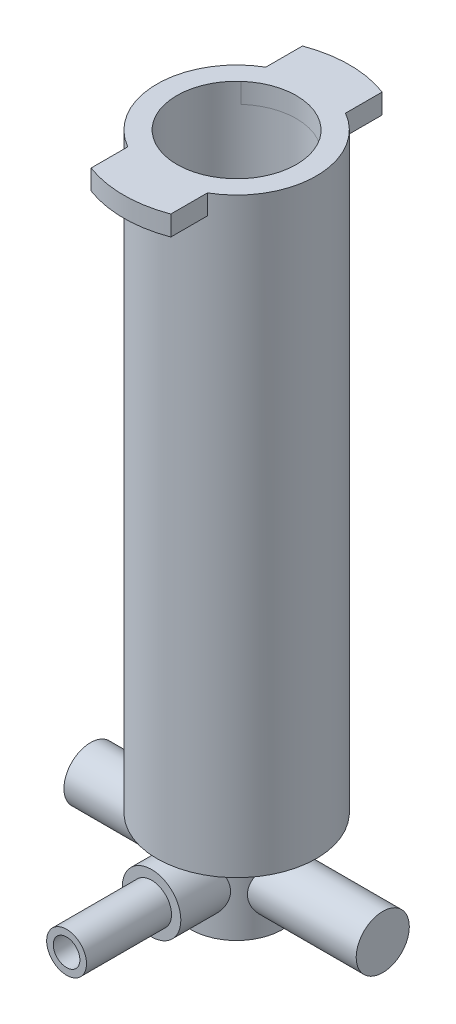
from build123d import *

# Parameters (mm, degrees)
SKETCH1_R           = 6
BOSS_EXTRUDE1_DEPTH = 44.5
SHELL1_T            = -1.5
SKETCH3_R           = 3.45
BOSS_EXTRUDE3_DEPTH = 5.9
SHELL2_START        = -4.4
SHELL2_OUTLINE_R    = 1.95
SHELL2_DEPTH        = 5.9
SKETCH5_R           = 2.2
BOSS_EXTRUDE4_DEPTH = 6.4
SKETCH6_R           = 1.5
BOSS_EXTRUDE5_DEPTH = 6.4
SKETCH7_R           = 1
CUT_EXTRUDE1_DEPTH  = 12.4
SKETCH8_R           = 1.95
CUT_EXTRUDE2_DEPTH  = 51.902357509
SKETCH9_R           = 2
BOSS_EXTRUDE6_DEPTH = 11
SKETCH10_R          = 1.975
CUT_EXTRUDE3_DEPTH  = 52.730551947
SKETCH11_R          = 1
CUT_EXTRUDE4_DEPTH  = 12
BOSS_EXTRUDE9_DEPTH = 1.5


# Read off the part's stored shape, not the designer's step: Shell2
with BuildPart() as part:
    # Sketch1 → Boss-Extrude1 (new body)
    with BuildSketch(Plane(origin=(0, 0, 0), x_dir=(1, 0, 0), z_dir=(0, 1, 0))):
        with Locations(Location((0, 0, 0), (0, 0, 270))):
            Circle(SKETCH1_R)
    extrude(amount=BOSS_EXTRUDE1_DEPTH)

    # Shell1
    shell1_openings = [part.faces().sort_by_distance(p)[0] for p in [
        (0, 44.5, 0),
    ]]
    offset(amount=SHELL1_T, openings=shell1_openings, kind=Kind.INTERSECTION)

    # Sketch3 → Boss-Extrude3 (add)
    with BuildSketch(Plane.XZ):
        with Locations(Location((0, 0, 0), (0, 0, 270))):
            Circle(SKETCH3_R)
    extrude(amount=BOSS_EXTRUDE3_DEPTH)

    # Shell2 outline → Shell2 (cut)
    with BuildSketch(Plane(origin=(0, 0, 0), x_dir=(1, 0, 0), z_dir=(0, 1, 0)).offset(SHELL2_START)):
        Circle(SHELL2_OUTLINE_R)
    extrude(amount=SHELL2_DEPTH, mode=Mode.SUBTRACT)

    # Sketch5 → Boss-Extrude4 (add)
    with BuildSketch(Plane.XY):
        with Locations(Location((0, -2.70320485, 0), (0, 0, 270))):
            Circle(SKETCH5_R)
    extrude(amount=BOSS_EXTRUDE4_DEPTH)

    # Sketch6 → Boss-Extrude5 (add)
    with BuildSketch(Plane.XY.offset(6.4)):
        with Locations((0, -2.70320485)):
            Circle(SKETCH6_R)
    extrude(amount=BOSS_EXTRUDE5_DEPTH)

    # Sketch7 → Cut-Extrude1 (cut)
    with BuildSketch(Plane.XY.offset(12.8)):
        with Locations((0, -2.70320485)):
            Circle(SKETCH7_R)
    extrude(amount=-CUT_EXTRUDE1_DEPTH, mode=Mode.SUBTRACT)

    # Sketch8 → Cut-Extrude2 (cut, through all)
    with BuildSketch(Plane(origin=(0, -4.4, 0), x_dir=(1, 0, 0), z_dir=(0, 1, 0))):
        with Locations(Location((0, 0, 0), (0, 0, 270))):
            Circle(SKETCH8_R)
    extrude(amount=CUT_EXTRUDE2_DEPTH, mode=Mode.SUBTRACT)

    # Sketch9 → Boss-Extrude6 (add)
    with BuildSketch(Plane(origin=(0, 0, 0), x_dir=(0, 0, -1), z_dir=(1, 0, 0))):
        with Locations(Location((0, -2.934503104, 0), (0, 0, 180))):
            Circle(SKETCH9_R)
    extrude(amount=BOSS_EXTRUDE6_DEPTH)

    # Sketch10 → Cut-Extrude3 (cut, through all)
    with BuildSketch(Plane(origin=(0, -4.4, 0), x_dir=(1, 0, 0), z_dir=(0, 1, 0))):
        with Locations(Location((0, -0.025, 0), (0, 0, 270))):
            Circle(SKETCH10_R)
    extrude(amount=CUT_EXTRUDE3_DEPTH, mode=Mode.SUBTRACT)

    # Sketch11 → Cut-Extrude4 (cut)
    with BuildSketch(Plane.XY.offset(12.8)):
        with Locations((0, -2.70320485)):
            Circle(SKETCH11_R)
    extrude(amount=-CUT_EXTRUDE4_DEPTH, mode=Mode.SUBTRACT)

    # Mirror5: part across plane


with BuildPart() as part_1:
    add(part.part)
    add(part.part.mirror(Plane(origin=(0, 0, 0), x_dir=(0, 0, 1), z_dir=(1, 0, 0))))

    # Sketch14 → Boss-Extrude9 (add)
    with BuildSketch(Plane(origin=(0, 44.5, 0), x_dir=(1, 0, 0), z_dir=(0, 1, 0))):
        with BuildLine():
            Line((-3, -3.346313625), (-3, -7.95298686))
            ThreePointArc((-3, -7.95298686), (0, -8.5), (3, -7.95298686))
            Line((3, -7.95298686), (3, -3.346313625))
            ThreePointArc((3, -3.346313625), (0, -4.494197912), (-3, -3.346313625))
        make_face()
        with BuildLine():
            Line((3, 3.346313625), (3, 7.95298686))
            ThreePointArc((3, 7.95298686), (0, 8.5), (-3, 7.95298686))
            Line((-3, 7.95298686), (-3, 3.346313625))
            ThreePointArc((-3, 3.346313625), (0, 4.494197912), (3, 3.346313625))
        make_face()
    extrude(amount=-BOSS_EXTRUDE9_DEPTH)


solid = part_1.part
